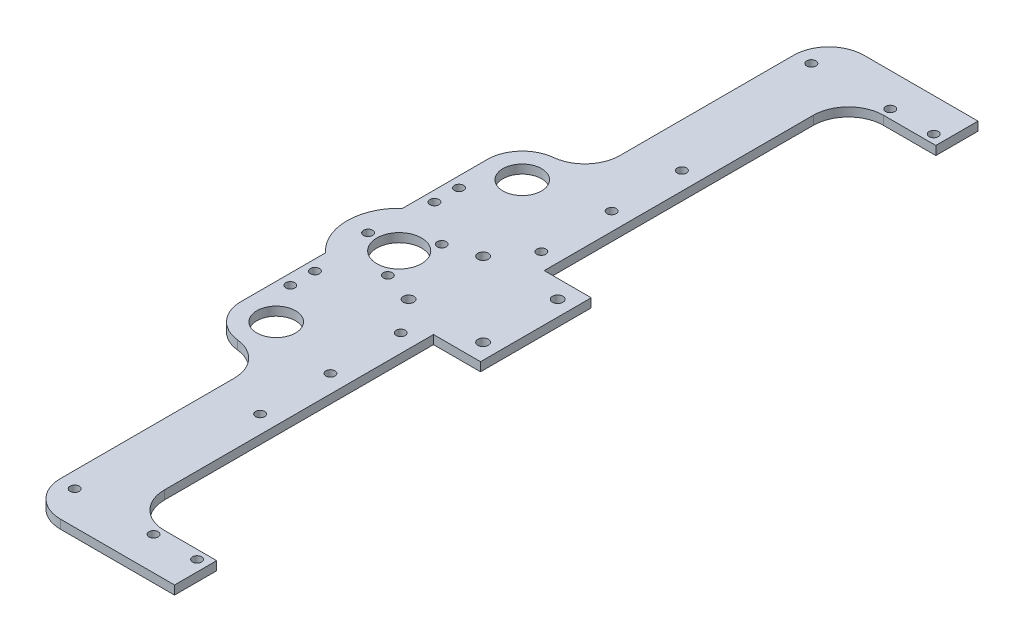
from build123d import *

# Parameters (mm, degrees)
SKETCH1_R           = 6.985
SKETCH1_R_2         = 1.6499967
SKETCH1_R_3         = 8.0645
BOSS_EXTRUDE1_DEPTH = 3.175
SKETCH4_R           = 1.65
CUT_EXTRUDE1_DEPTH  = 199.349545248
SKETCH5_R           = 1.89865
CUT_EXTRUDE2_DEPTH  = 199.349545248


with BuildPart() as part:
    # Sketch1 → Boss-Extrude1 (new body)
    with BuildSketch(Plane(origin=(0, 0, 0), x_dir=(1, 0, 0), z_dir=(0, 1, 0))):
        with BuildLine():
            ThreePointArc((-67.971311517, -24.866245744), (-74.128017531, -38.797272158), (-67.971311517, -52.728298572))
            Line((-67.971311517, -52.728298572), (-67.971311517, -82.586411585))
            ThreePointArc((-67.971311517, -82.586411585), (-64.941959488, -91.499608698), (-56.608448003, -95.878494725))
            ThreePointArc((-56.608448003, -95.878494725), (-48.492989851, -100.008926653), (-45.228378476, -108.509717293))
            Line((-45.228378476, -108.509717293), (-45.228378476, -171.249717293))
            ThreePointArc((-45.228378476, -171.249717293), (-41.508634597, -180.229973414), (-32.528378476, -183.949717293))
            Line((-32.528378476, -183.949717293), (7.398418219, -183.949717293))
            Line((7.398418219, -183.949717293), (8.682280525, -183.949717293))
            Line((8.682280525, -183.949717293), (8.682280525, -168.709717293))
            Line((8.682280525, -168.709717293), (-10.203517531, -168.709717293))
            ThreePointArc((-10.203517531, -168.709717293), (-19.183773652, -164.989973414), (-22.903517531, -156.009717293))
            Line((-22.903517531, -156.009717293), (-22.903517531, -58.797272158))
            Line((-22.903517531, -58.797272158), (-5.903517531, -58.797272158))
            Line((-5.903517531, -58.797272158), (-5.903517531, -38.797272158))
            Line((-5.903517531, -38.797272158), (-5.903517531, -18.797272158))
            Line((-5.903517531, -18.797272158), (-22.903517531, -18.797272158))
            Line((-22.903517531, -18.797272158), (-22.903517531, 78.415172977))
            ThreePointArc((-22.903517531, 78.415172977), (-19.183773652, 87.395429098), (-10.203517531, 91.115172977))
            Line((-10.203517531, 91.115172977), (8.682280525, 91.115172977))
            Line((8.682280525, 91.115172977), (8.682280525, 106.355172977))
            Line((8.682280525, 106.355172977), (-32.528378476, 106.355172977))
            ThreePointArc((-32.528378476, 106.355172977), (-41.508634597, 102.635429098), (-45.228378476, 93.655172977))
            Line((-45.228378476, 93.655172977), (-45.228378476, 30.915172977))
            ThreePointArc((-45.228378476, 30.915172977), (-48.492989851, 22.414382337), (-56.608448003, 18.28395041))
            ThreePointArc((-56.608448003, 18.28395041), (-64.941959488, 13.905064383), (-67.971311517, 4.991867269))
            Line((-67.971311517, 4.991867269), (-67.971311517, -24.866245744))
        make_face()
        with Locations((-55.288517531, -83.247272158)):
            Circle(SKETCH1_R, mode=Mode.SUBTRACT)
        with Locations((-64.161311517, -69.277272158)):
            Circle(SKETCH1_R_2, mode=Mode.SUBTRACT)
        with Locations((-64.161311517, -60.387272158)):
            Circle(SKETCH1_R_2, mode=Mode.SUBTRACT)
        with Locations((-66.528017531, -38.797272158)):
            Circle(SKETCH1_R_2, mode=Mode.SUBTRACT)
        with Locations((-55.288517531, -38.797272158)):
            Circle(SKETCH1_R_3, mode=Mode.SUBTRACT)
        with Locations((-49.668767531, -48.530964684)):
            Circle(SKETCH1_R_2, mode=Mode.SUBTRACT)
        with Locations((-29.342032123, -114.997272158)):
            Circle(SKETCH1_R_2, mode=Mode.SUBTRACT)
        with Locations((-29.342032123, -89.597272158)):
            Circle(SKETCH1_R_2, mode=Mode.SUBTRACT)
        with Locations((-29.342032123, -64.197272158)):
            Circle(SKETCH1_R_2, mode=Mode.SUBTRACT)
        with Locations((-64.161311517, -17.207272158)):
            Circle(SKETCH1_R_2, mode=Mode.SUBTRACT)
        with Locations((-64.161311517, -8.317272158)):
            Circle(SKETCH1_R_2, mode=Mode.SUBTRACT)
        with Locations((-55.288517531, 5.652727842)):
            Circle(SKETCH1_R, mode=Mode.SUBTRACT)
        with Locations((-49.668767531, -29.063579632)):
            Circle(SKETCH1_R_2, mode=Mode.SUBTRACT)
        with Locations((-29.342032123, -13.397272158)):
            Circle(SKETCH1_R_2, mode=Mode.SUBTRACT)
        with Locations((-29.342032123, 12.002727842)):
            Circle(SKETCH1_R_2, mode=Mode.SUBTRACT)
        with Locations((-29.342032123, 37.402727842)):
            Circle(SKETCH1_R_2, mode=Mode.SUBTRACT)
    extrude(amount=BOSS_EXTRUDE1_DEPTH)

    # Sketch4 → Cut-Extrude1 (cut, through all)
    with BuildSketch(Plane(origin=(0, 3.175, 0), x_dir=(1, 0, 0), z_dir=(0, 1, 0))):
        with Locations((4.753970241, 94.290172977)):
            Circle(SKETCH4_R)
        with Locations((-10.971029759, 94.290172977)):
            Circle(SKETCH4_R)
        with Locations((-39.471029759, 94.290172977)):
            Circle(SKETCH4_R)
        with Locations((-39.471029759, -171.884717293)):
            Circle(SKETCH4_R)
        with Locations((-10.971029759, -171.884717293)):
            Circle(SKETCH4_R)
        with Locations((4.753970241, -171.884717293)):
            Circle(SKETCH4_R)
    extrude(amount=-CUT_EXTRUDE1_DEPTH, mode=Mode.SUBTRACT)

    # Sketch5 → Cut-Extrude2 (cut, through all)
    with BuildSketch(Plane(origin=(0, 3.175, 0), x_dir=(1, 0, 0), z_dir=(0, 1, 0))):
        with Locations((-11.500645577, -25.326887976)):
            Circle(SKETCH5_R)
        with Locations((-38.441413941, -25.326887976)):
            Circle(SKETCH5_R)
        with Locations((-38.441413941, -52.267656339)):
            Circle(SKETCH5_R)
        with Locations((-11.500645577, -52.267656339)):
            Circle(SKETCH5_R)
    extrude(amount=-CUT_EXTRUDE2_DEPTH, mode=Mode.SUBTRACT)


solid = part.part
